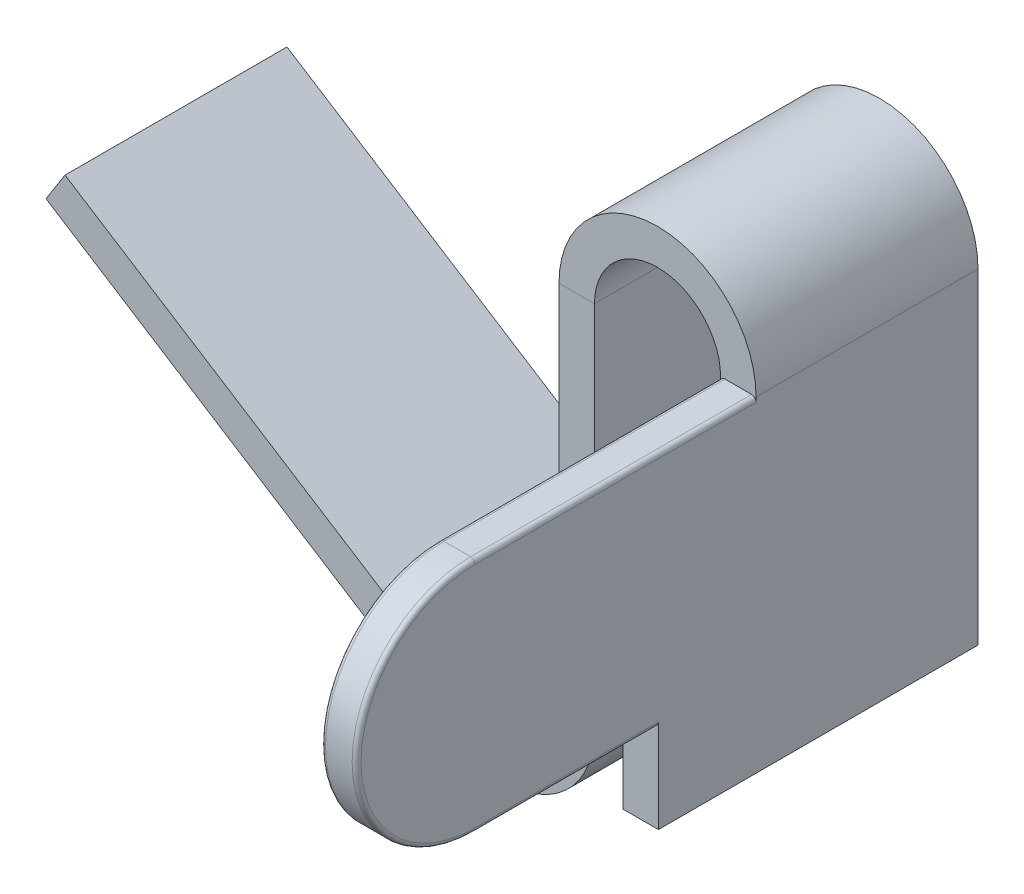
from build123d import *

# Parameters (mm, degrees)
BASE_FLANGE1_DEPTH  = 2.5
SKETCH6_W           = 0.4
SKETCH6_H           = 3.67
BOSS_EXTRUDE1_DEPTH = 4.5
SKETCH7_W           = 3.4
SKETCH7_H           = 1
CUT_EXTRUDE1_DEPTH  = 12.139958989
FILLET1_RADIUS      = 1.335
FILLET1_LENGTH      = 0.4
FILLET2_R           = 0.05
SCALE1_SCALE        = 0.445


# Sheet-metal steps are written as plain solids
with BuildPart() as part:
    # Sketch1 → Base-Flange1 (new body)
    with BuildSketch(Plane.XY):
        with BuildLine():
            Line((0.71, -1.835), (0.71, 1.835))
            ThreePointArc((0.71, 1.835), (0, 2.545), (-0.71, 1.835))
            Line((-0.71, 1.835), (-0.71, -2.335))
            ThreePointArc((-0.71, -2.335), (-1.228475759, -3.211432773), (-2.246268811, -3.179047252))
            Line((-2.246268811, -3.179047252), (-6.888528694, -0.229568793))
            Line((-6.888528694, -0.229568793), (-6.67402117, 0.108050107))
            Line((-6.67402117, 0.108050107), (-2.031761286, -2.841428351))
            ThreePointArc((-2.031761286, -2.841428351), (-1.421085455, -2.860859664), (-1.11, -2.335))
            Line((-1.11, -2.335), (-1.11, 1.835))
            ThreePointArc((-1.11, 1.835), (0, 2.945), (1.11, 1.835))
            Line((1.11, 1.835), (1.11, -1.835))
            Line((1.11, -1.835), (0.71, -1.835))
        make_face()
    extrude(amount=BASE_FLANGE1_DEPTH)

    # Sketch6 → Boss-Extrude1 (add)
    with BuildSketch(Plane.XY.offset(2.5)):
        with Locations((0.91, 0)):
            Rectangle(SKETCH6_W, SKETCH6_H)
    extrude(amount=BOSS_EXTRUDE1_DEPTH)

    # Sketch7 → Cut-Extrude1 (cut, through all)
    with BuildSketch(Plane(origin=(1.11, 0, 0), x_dir=(0, 0, -1), z_dir=(1, 0, 0))):
        with Locations((-5.3, -1.335)):
            Rectangle(SKETCH7_W, SKETCH7_H)
    extrude(amount=-CUT_EXTRUDE1_DEPTH, mode=Mode.SUBTRACT)

    # Fillet1: full round fillet: the end face becomes a half cylinder, R = half its width
    fillet1_face = Plane((0.91, 0.5, 7), x_dir=(-1, 0, 0), z_dir=(0, 0, 1))  # on the end face: x along it, z out of the body
    fillet1_slab = fillet1_face.offset(-FILLET1_RADIUS / 2) * Box(FILLET1_LENGTH, 2 * FILLET1_RADIUS, FILLET1_RADIUS, mode=Mode.PRIVATE)  # the body's end, R deep
    fillet1_round = Plane((0.91, 0.5, 5.665), x_dir=(0, 0, 1), z_dir=(-1, 0, 0)) * Cylinder(FILLET1_RADIUS, FILLET1_LENGTH, mode=Mode.PRIVATE)  # its axis R under the face
    add(fillet1_slab - fillet1_round, mode=Mode.SUBTRACT)

    # Fillet2
    fillet2_edges = [part.edges().sort_by_distance(p)[0] for p in [
        (0.71, 1.835, 4.0825),
        (1.11, 1.835, 4.0825),
        (0.71, -0.835, 4.6325),
        (1.11, -0.835, 4.6325),
        (0.71, 0.5, 7),
        (1.11, 0.5, 7),
    ]]
    fillet(fillet2_edges, radius=FILLET2_R)


with BuildPart() as part_1:
    # Scale1: scaled about (0, 0, 0)
    add(part.part.scale(SCALE1_SCALE))


solid = part_1.part
